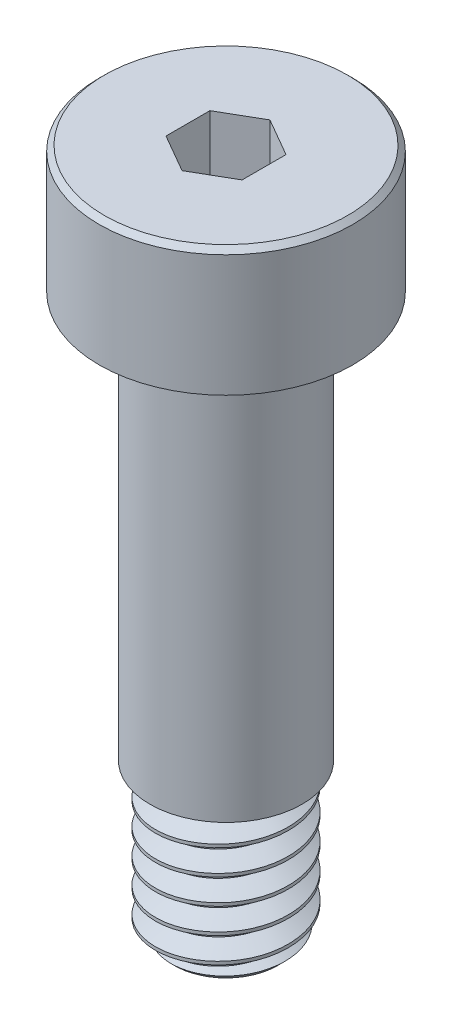
from build123d import *

# Parameters (mm, degrees)
SKETCH1_R          = 3.96875
EXTRUDE1_DEPTH     = 3.96875
CUT_EXTRUDE1_DEPTH = 1.984375
SKETCH4_R          = 2.38125
EXTRUDE2_DEPTH     = 12.7
SKETCH5_R          = 2.0828
EXTRUDE3_DEPTH     = 4.7625
CHAMFER1_SIZE      = 0.47625
CUT_SWEEP1_PITCH   = 0.79375
CUT_SWEEP1_TO      = 4.7625


with BuildPart() as part:
    # Sketch1 → Extrude1 (new body)
    with BuildSketch(Plane(origin=(0, 0, 0), x_dir=(1, 0, 0), z_dir=(0, 1, 0))):
        with Locations(Location((0, 0, 0), (0, 0, 270))):
            Circle(SKETCH1_R)
    extrude(amount=EXTRUDE1_DEPTH)

    # Sketch2 → Cut-Extrude1 (cut)
    with BuildSketch(Plane(origin=(0, 3.96875, 0), x_dir=(-1, 0, 0), z_dir=(0, 1, 0))):
        Polygon((0, -1.374815329), (1.190625, -0.687407664), (1.190625, 0.687407664), (0, 1.374815329), (-1.190625, 0.687407664), (-1.190625, -0.687407664), align=None)
    extrude(amount=-CUT_EXTRUDE1_DEPTH, mode=Mode.SUBTRACT)

    # Sketch4 → Extrude2 (add)
    with BuildSketch(Plane.XZ):
        with Locations(Location((0, 0, 0), (0, 0, 90))):
            Circle(SKETCH4_R)
    extrude(amount=EXTRUDE2_DEPTH)

    # Sketch5 → Extrude3 (add)
    with BuildSketch(Plane.XZ.offset(12.7)):
        with Locations(Location((0, 0, 0), (0, 0, 90))):
            Circle(SKETCH5_R)
    extrude(amount=EXTRUDE3_DEPTH)

    # Chamfer1
    chamfer1_edges = [part.edges().sort_by_distance(p)[0] for p in [
        (0, -17.4625, -2.0828),
    ]]
    chamfer(chamfer1_edges, length=CHAMFER1_SIZE)

    # Cut-Sweep1: arcs per turn and ends read off the stored shape
    # Cut-Sweep1: the profile of Sketch13 profile screwed along a right-hand helix through 7 turns, 6 arcs to a turn; built about Z, then put on its axis
    cut_sweep1_z = Axis((0, 0, 0), (0, 0, 1))
    cut_sweep1_corners = [(2.0831, 0, -0.099045545), (2.0831, 0, -0.793923205), (1.567244252, 0, -0.49609375), (1.567244252, 0, -0.396875)]
    with BuildLine(mode=Mode.PRIVATE) as cut_sweep1_profile:
        Line(cut_sweep1_corners[0], cut_sweep1_corners[1])
        Line(cut_sweep1_corners[1], cut_sweep1_corners[2])
        Line(cut_sweep1_corners[2], cut_sweep1_corners[3])
        Line(cut_sweep1_corners[3], cut_sweep1_corners[0])
    cut_sweep1_cap = Face(cut_sweep1_profile.wire())
    cut_sweep1_turn_angles = [0, 30, 60, 90, 120, 150, 180, 210, 240, 270, 300, 330, 360]
    cut_sweep1_turn_weights = [1, 0.8660254037844387, 1, 0.8660254037844387, 1, 0.8660254037844387, 1, 0.8660254037844387, 1, 0.8660254037844387, 1, 0.8660254037844387, 1]
    cut_sweep1_turn_rails = [Edge.make_bspline([Vector(p[0], p[1], 0).rotate(cut_sweep1_z, cut_sweep1_turn_angles[k]) / cut_sweep1_turn_weights[k] + Vector(0, 0, p[2] + CUT_SWEEP1_PITCH * cut_sweep1_turn_angles[k] / 360) for k in range(13)], [0, 0, 0, 1, 1, 2, 2, 3, 3, 4, 4, 5, 5, 6, 6, 6], 2, cut_sweep1_turn_weights) for p in cut_sweep1_corners]
    cut_sweep1_turn_sides = [Face.make_surface_from_curves(cut_sweep1_turn_rails[p[0]], cut_sweep1_turn_rails[p[1]]) for p in [(0, 1), (1, 2), (2, 3), (3, 0)]]
    cut_sweep1 = Plane(origin=(0, -17.4625, 0), x_dir=(0.7071067811865438, 0, 0.7071067811865512), z_dir=(0, 1, 0)) * split(Solid(Shell([*[p.moved(Location((0, 0, CUT_SWEEP1_PITCH * i))) for i in range(7) for p in cut_sweep1_turn_sides], cut_sweep1_cap, cut_sweep1_cap.rotate(cut_sweep1_z, 2520).moved(Location((0, 0, CUT_SWEEP1_PITCH * 2520 / 360)))])), bisect_by=Plane.XY.offset(CUT_SWEEP1_TO), keep=Keep.BOTTOM, mode=Mode.PRIVATE)
    add(cut_sweep1, mode=Mode.SUBTRACT)

    # Sketch11 → Cut-Revolve7 (revolve, cut)
    with BuildSketch(Plane.XY, mode=Mode.PRIVATE) as cut_revolve7_sk:
        Polygon((3.96875, 3.806888221), (3.806888221, 3.96875), (3.96875, 3.96875), align=None)
    revolve(cut_revolve7_sk.sketch.rotate(Axis((0, 14.544175091, 0), (0, -1, 0)), 90), axis=Axis((0, 14.544175091, 0), (0, -1, 0)), mode=Mode.SUBTRACT)


solid = part.part
